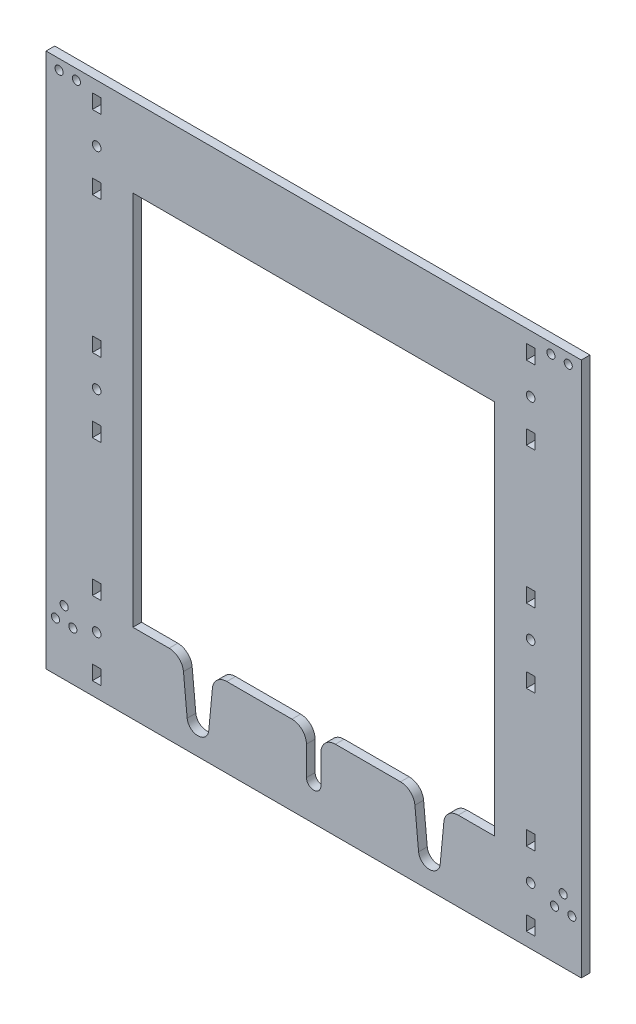
from build123d import *

# Parameters (mm, degrees)
SKETCH1_W           = 370
SKETCH1_H           = 370
SKETCH1_R           = 3
SKETCH1_R_2         = 2.8
SKETCH1_W_2         = 6
SKETCH1_H_2         = 10
BOSS_EXTRUDE1_DEPTH = 3


with BuildPart() as part:
    # Sketch1 → Boss-Extrude1 (new, symmetric)
    with BuildSketch(Plane.XY):
        Rectangle(SKETCH1_W, SKETCH1_H)
        with Locations((-150, 145.5)):
            Circle(SKETCH1_R, mode=Mode.SUBTRACT)
        with Locations((-150, 0)):
            Circle(SKETCH1_R, mode=Mode.SUBTRACT)
        with Locations((-150, -145.5)):
            Circle(SKETCH1_R, mode=Mode.SUBTRACT)
        with Locations((150, -145.5)):
            Circle(SKETCH1_R, mode=Mode.SUBTRACT)
        with Locations((150, 0)):
            Circle(SKETCH1_R, mode=Mode.SUBTRACT)
        with Locations((150, 145.5)):
            Circle(SKETCH1_R, mode=Mode.SUBTRACT)
        with Locations((-178.5, -151.196)):
            Circle(SKETCH1_R_2, mode=Mode.SUBTRACT)
        with Locations((-166.5, -151.196)):
            Circle(SKETCH1_R_2, mode=Mode.SUBTRACT)
        with Locations((-172.5, -140.803695155)):
            Circle(SKETCH1_R_2, mode=Mode.SUBTRACT)
        with Locations((-176, 178)):
            Circle(SKETCH1_R_2, mode=Mode.SUBTRACT)
        with Locations((-164, 178)):
            Circle(SKETCH1_R_2, mode=Mode.SUBTRACT)
        with Locations((166.5, -151.196)):
            Circle(SKETCH1_R_2, mode=Mode.SUBTRACT)
        with Locations((172.5, -140.803695155)):
            Circle(SKETCH1_R_2, mode=Mode.SUBTRACT)
        with Locations((178.5, -151.196)):
            Circle(SKETCH1_R_2, mode=Mode.SUBTRACT)
        with Locations((164, 178)):
            Circle(SKETCH1_R_2, mode=Mode.SUBTRACT)
        with Locations((176, 178)):
            Circle(SKETCH1_R_2, mode=Mode.SUBTRACT)
        with BuildLine():
            Line((-125, 130), (125, 130))
            Line((125, 130), (125, -130))
            Line((125, -130), (99.955131042, -130))
            ThreePointArc((99.955131042, -130), (93.226920946, -132.601946952), (90, -139.053762221))
            Line((90, -139.053762221), (87.466348282, -165.709678335))
            ThreePointArc((87.466348282, -165.709678335), (80, -172.5), (72.533651718, -165.709678335))
            Line((72.533651718, -165.709678335), (70, -139.053762221))
            ThreePointArc((70, -139.053762221), (66.773079054, -132.601946952), (60.044868958, -130))
            Line((60.044868958, -130), (15, -130))
            ThreePointArc((15, -130), (7.928932188, -132.928932188), (5, -140))
            Line((5, -140), (5, -160))
            ThreePointArc((5, -160), (0, -165), (-5, -160))
            Line((-5, -160), (-5, -140))
            ThreePointArc((-5, -140), (-7.928932188, -132.928932188), (-15, -130))
            Line((-15, -130), (-60.044868958, -130))
            ThreePointArc((-60.044868958, -130), (-66.773079054, -132.601946952), (-70, -139.053762221))
            Line((-70, -139.053762221), (-72.533651718, -165.709678335))
            ThreePointArc((-72.533651718, -165.709678335), (-80, -172.5), (-87.466348282, -165.709678335))
            Line((-87.466348282, -165.709678335), (-90, -139.053762221))
            ThreePointArc((-90, -139.053762221), (-93.226920946, -132.601946952), (-99.955131042, -130))
            Line((-99.955131042, -130), (-125, -130))
            Line((-125, -130), (-125, 130))
        make_face(mode=Mode.SUBTRACT)
        with Locations((-150, 171)):
            Rectangle(SKETCH1_W_2, SKETCH1_H_2, mode=Mode.SUBTRACT)
        with Locations((-150, 120)):
            Rectangle(SKETCH1_W_2, SKETCH1_H_2, mode=Mode.SUBTRACT)
        with Locations((-150, 25.5)):
            Rectangle(SKETCH1_W_2, SKETCH1_H_2, mode=Mode.SUBTRACT)
        with Locations((-150, -25.5)):
            Rectangle(SKETCH1_W_2, SKETCH1_H_2, mode=Mode.SUBTRACT)
        with Locations((-150, -120)):
            Rectangle(SKETCH1_W_2, SKETCH1_H_2, mode=Mode.SUBTRACT)
        with Locations((-150, -171)):
            Rectangle(SKETCH1_W_2, SKETCH1_H_2, mode=Mode.SUBTRACT)
        with Locations((150, -171)):
            Rectangle(SKETCH1_W_2, SKETCH1_H_2, mode=Mode.SUBTRACT)
        with Locations((150, -120)):
            Rectangle(SKETCH1_W_2, SKETCH1_H_2, mode=Mode.SUBTRACT)
        with Locations((150, -25.5)):
            Rectangle(SKETCH1_W_2, SKETCH1_H_2, mode=Mode.SUBTRACT)
        with Locations((150, 25.5)):
            Rectangle(SKETCH1_W_2, SKETCH1_H_2, mode=Mode.SUBTRACT)
        with Locations((150, 120)):
            Rectangle(SKETCH1_W_2, SKETCH1_H_2, mode=Mode.SUBTRACT)
        with Locations((150, 171)):
            Rectangle(SKETCH1_W_2, SKETCH1_H_2, mode=Mode.SUBTRACT)
    extrude(amount=BOSS_EXTRUDE1_DEPTH, both=True)


solid = part.part
